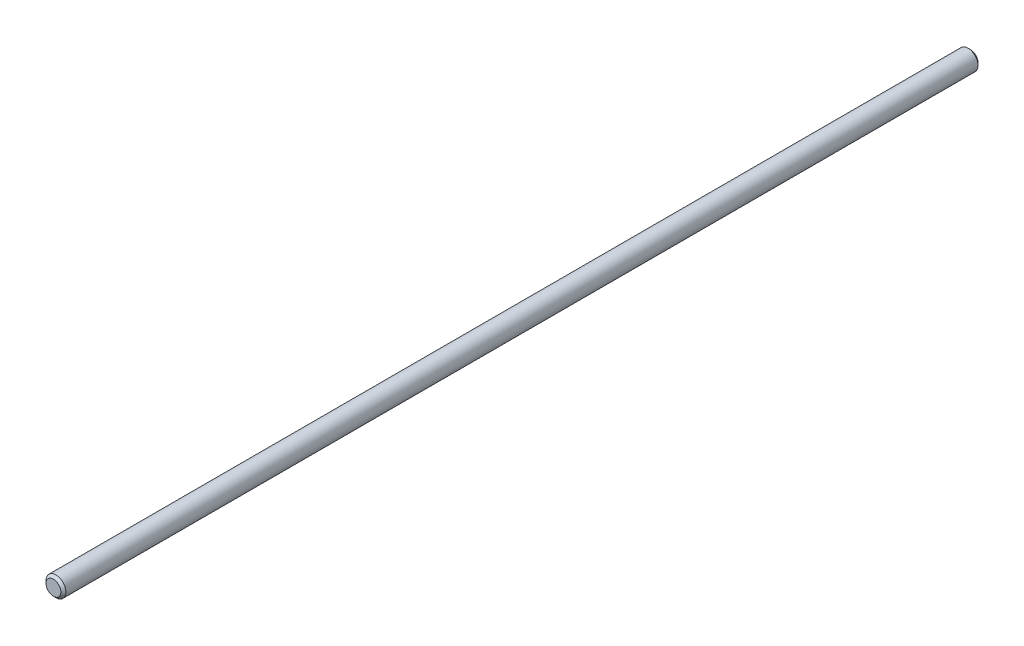
from build123d import *

# Parameters (mm, degrees)
SKETCH1_R           = 4
BOSS_EXTRUDE1_DEPTH = 370
CHAMFER1_SIZE       = 1


with BuildPart() as part:
    # Sketch1 → Boss-Extrude1 (new body)
    with BuildSketch(Plane.XY):
        Circle(SKETCH1_R)
    extrude(amount=BOSS_EXTRUDE1_DEPTH)

    # Chamfer1
    chamfer1_edges = [part.edges().sort_by_distance(p)[0] for p in [
        (-4, 0, 370),
        (-4, 0, 0),
    ]]
    chamfer(chamfer1_edges, length=CHAMFER1_SIZE)


solid = part.part
